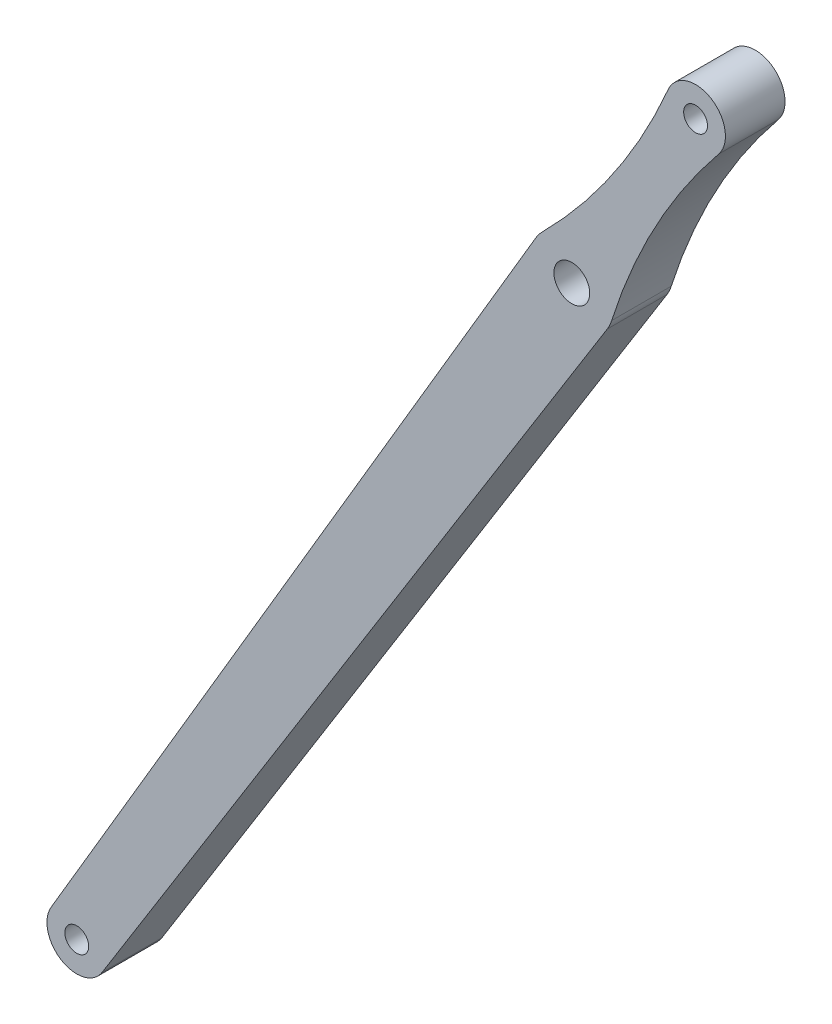
from build123d import *

# Parameters (mm, degrees)
BOSS_EXTRUDE1_DEPTH      = 5
BOSS_EXTRUDE1_DEPTH_BACK = 5
SKETCH1_R                = 3
SKETCH1_R_2              = 2


with BuildPart() as part:
    # Sketch1 → Boss-Extrude1 (new, two sides: drawn at the far end of the back side and taken through both)
    with BuildSketch(Plane.XY.offset(-BOSS_EXTRUDE1_DEPTH_BACK)):
        with BuildLine():
            Line((-230.58289428, -40.644043466), (-145.901048943, 95.094621144))
            ThreePointArc((-145.901048943, 95.094621144), (-145.483678124, 95.867820268), (-145.166457636, 96.687214218))
            ThreePointArc((-145.166457636, 96.687214218), (-137.770971911, 114.112981232), (-127.224080728, 129.832830196))
            ThreePointArc((-127.224080728, 129.832830196), (-128.500554052, 137.273973647), (-135.689707163, 134.968311583))
            ThreePointArc((-135.689707163, 134.968311583), (-144.758818243, 118.352000641), (-156.796804233, 103.742501731))
            ThreePointArc((-156.796804233, 103.742501731), (-157.376958621, 103.082610701), (-157.869874927, 102.355239544))
            Line((-157.869874927, 102.355239544), (-239.132055698, -35.457887466))
            ThreePointArc((-239.132055698, -35.457887466), (-237.41833959, -42.272443732), (-230.58289428, -40.644043466))
        make_face()
        with Locations((-151.840079524, 98.799741351)):
            Circle(SKETCH1_R, mode=Mode.SUBTRACT)
        with Locations((-234.825058982, -37.997529032)):
            Circle(SKETCH1_R_2, mode=Mode.SUBTRACT)
        with Locations((-131.09383466, 132.999058947)):
            Circle(SKETCH1_R_2, mode=Mode.SUBTRACT)
    extrude(amount=BOSS_EXTRUDE1_DEPTH + BOSS_EXTRUDE1_DEPTH_BACK)


solid = part.part
